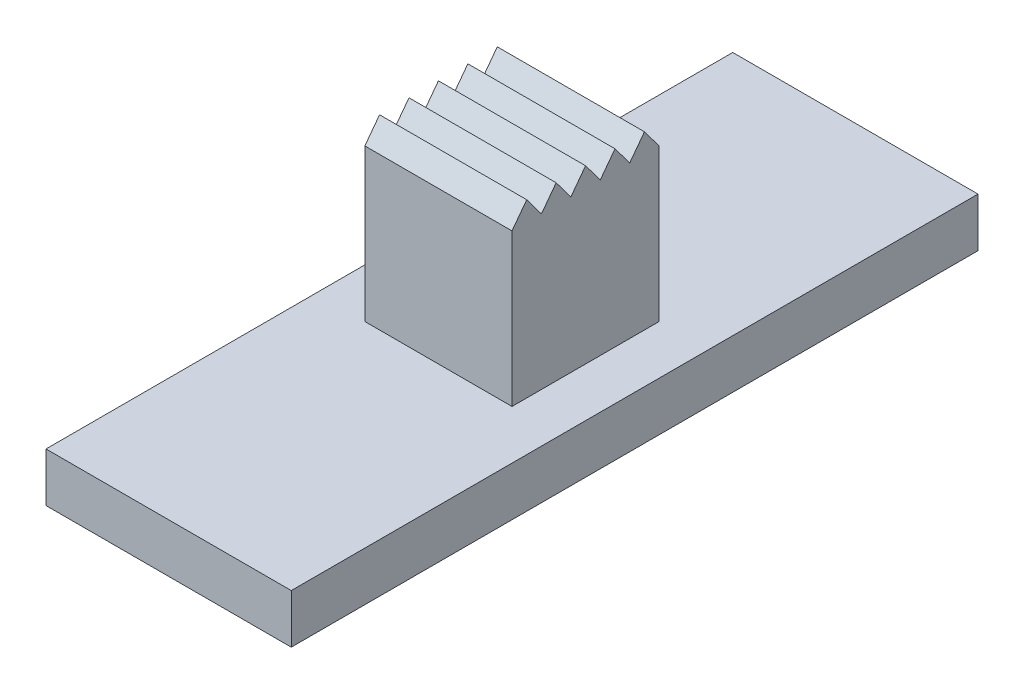
from build123d import *

# Parameters (mm, degrees)
BOSS_EXTRU_1_DEPTH      = 1.5
BOSS_EXTRU_1_DEPTH_BACK = 1.5
ESQUISSE2_W             = 14
ESQUISSE2_H             = 1
BOSS_EXTRU_2_DEPTH      = 1


with BuildPart() as part:
    # Esquisse1 → Boss.-Extru.1 (new, two sides: drawn at the far end of the back side and taken through both)
    with BuildSketch(Plane(origin=(0, 0, 0), x_dir=(0, 0, -1), z_dir=(1, 0, 0)).offset(-BOSS_EXTRU_1_DEPTH_BACK)):
        Polygon((-7, 0), (-1.5, 0), (-1.5, 3.1), (-1.2, 3.5), (-0.9, 3.1), (-0.6, 3.5), (-0.3, 3.1), (0, 3.5), (0.3, 3.1), (0.6, 3.5), (0.9, 3.1), (1.2, 3.5), (1.5, 3.1), (1.5, 0), (7, 0), (7, -1), (-7, -1), align=None)
    extrude(amount=BOSS_EXTRU_1_DEPTH + BOSS_EXTRU_1_DEPTH_BACK)

    # Esquisse2 → Boss.-Extru.2 (add)
    with BuildSketch(Plane(origin=(1.5, 0, 0), x_dir=(0, 0, -1), z_dir=(1, 0, 0))):
        with Locations((0, -0.5)):
            Rectangle(ESQUISSE2_W, ESQUISSE2_H)
    boss_extru_2 = extrude(amount=BOSS_EXTRU_2_DEPTH)

    # Symétrie1: Boss.-Extru.2 across plane
    add(boss_extru_2.mirror(Plane(origin=(0, 0, 0), x_dir=(0, 0, 1), z_dir=(1, 0, 0))))


solid = part.part
